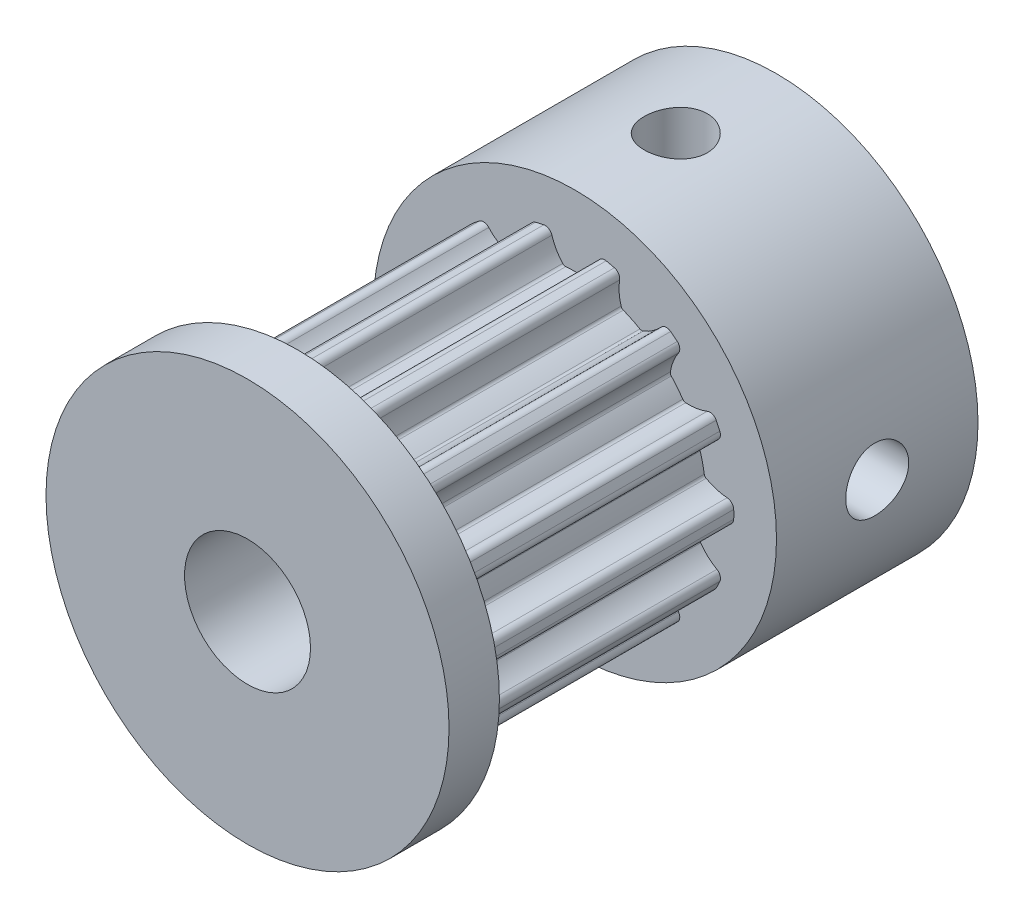
from build123d import *

# Parameters (mm, degrees)
SKETCH_1_R               = 6.305
EXTRUDE_1_DEPTH          = 5.5
CUT_EXTRUDE_1_DEPTH      = 15.16001589
PATTERN_CIRCULAR_1_COUNT = 14
SKETCH_3_R               = 8
EXTRUDE_2_DEPTH          = 2
EXTRUDE_START            = 8
SKETCH_5_R               = 8
EXTRUDE_3_DEPTH          = 8
SKETCH_4_R               = 2.5
CUT_EXTRUDE_2_DEPTH      = 24.853720884
SKETCH_7_W               = 1.25
SKETCH_7_H               = 8
PATTERN_CIRCULAR_2_COUNT = 2
PATTERN_CIRCULAR_2_ANGLE = 90


with BuildPart() as part:
    # 草圖1 → 填料-伸長1 (new, symmetric)
    with BuildSketch(Plane.XY):
        Circle(SKETCH_1_R)
    extrude(amount=EXTRUDE_1_DEPTH, both=True)

    # 草圖2 → 除料-伸長1 (cut, symmetric)
    with BuildSketch(Plane.XY.offset(5.5)):
        with BuildLine():
            Line((-39.653021357, -1.515962662), (-1.238867566, 6.182089627))
            ThreePointArc((-1.238867566, 6.182089627), (-1.039898347, 6.14770999), (-0.915789196, 5.988437808))
            ThreePointArc((-0.915789196, 5.988437808), (-0.743543104, 5.58574022), (-0.486778479, 5.23090788))
            ThreePointArc((-0.486778479, 5.23090788), (-0.431598805, 5.192557356), (-0.365212221, 5.182146759))
            ThreePointArc((-0.365212221, 5.182146759), (0, 5.195), (0.365212221, 5.182146759))
            ThreePointArc((0.365212221, 5.182146759), (0.431598805, 5.192557356), (0.486778479, 5.23090788))
            ThreePointArc((0.486778479, 5.23090788), (0.743543104, 5.58574022), (0.915789196, 5.988437808))
            ThreePointArc((0.915789196, 5.988437808), (1.039898347, 6.14770999), (1.238867566, 6.182089627))
            Line((1.238867566, 6.182089627), (39.653021357, -1.515962662))
            Line((39.653021357, -1.515962662), (39.653021357, 76.839821312))
            Line((39.653021357, 76.839821312), (-39.653021357, 76.839821312))
            Line((-39.653021357, 76.839821312), (-39.653021357, -1.515962662))
        make_face()
    cut_extrude_1 = extrude(amount=CUT_EXTRUDE_1_DEPTH, both=True, mode=Mode.SUBTRACT)

    # 環狀複製排列1: 除料-伸長1 ×14 about axis
    pattern_circular_1_axis = Axis((0, 0, 5.5), (0, 0, 1))
    for i in range(1, PATTERN_CIRCULAR_1_COUNT):
        add(cut_extrude_1.rotate(pattern_circular_1_axis, i * 360 / PATTERN_CIRCULAR_1_COUNT), mode=Mode.SUBTRACT)

    # 草圖3 → 填料-伸長2 (add)
    with BuildSketch(Plane.XY.offset(5.5)):
        Circle(SKETCH_3_R)
    extrude(amount=EXTRUDE_2_DEPTH)

    # 草圖5 → 填料-伸長3 (add)
    with BuildSketch(Plane(origin=(0, 0, -5.5), x_dir=(-1, 0, 0), z_dir=(0, 0, -1)).offset(EXTRUDE_START)):
        Circle(SKETCH_5_R)
    extrude(amount=-EXTRUDE_3_DEPTH)

    # 草圖4 → 除料-伸長2 (cut, through all)
    with BuildSketch(Plane.XY.offset(7.5)):
        Circle(SKETCH_4_R)
    extrude(amount=-CUT_EXTRUDE_2_DEPTH, mode=Mode.SUBTRACT)

    # 草圖7 → M3x0.5 螺紋孔1 (revolve, cut)
    with BuildSketch(Plane(origin=(0, 0, -9.5), x_dir=(0, 0, -1), z_dir=(1, 0, 0))):
        with Locations((0.625, 4)):
            Rectangle(SKETCH_7_W, SKETCH_7_H)
    m3x0_5_1 = revolve(axis=Axis((0, -6.35, -9.5), (0, 1, 0)), mode=Mode.SUBTRACT)

    # 環狀複製排列2: M3x0.5 螺紋孔1 ×2 about axis
    pattern_circular_2_axis = Axis((0, 0, -13.5), (0, 0, -1))
    for i in range(1, PATTERN_CIRCULAR_2_COUNT):
        add(m3x0_5_1.rotate(pattern_circular_2_axis, i * PATTERN_CIRCULAR_2_ANGLE / (PATTERN_CIRCULAR_2_COUNT - 1)), mode=Mode.SUBTRACT)


solid = part.part
